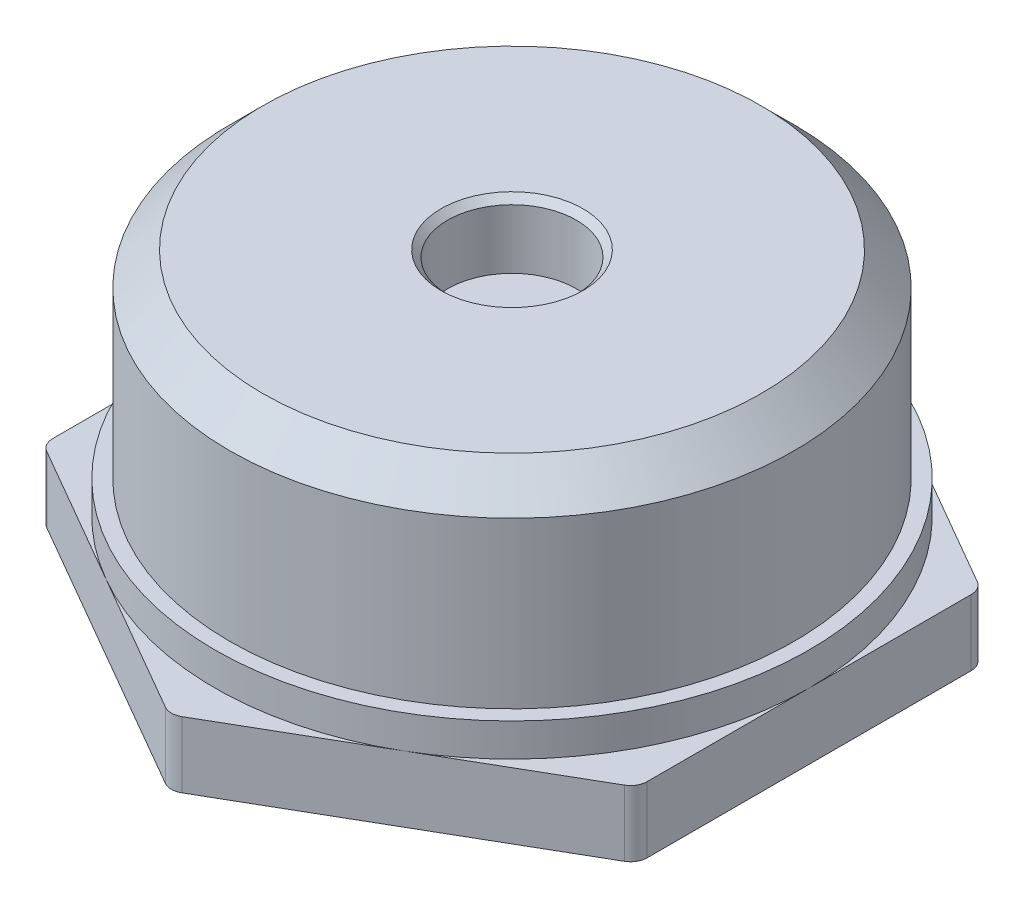
from build123d import *

# Parameters (mm, degrees)
BOSS_EXTRUDE1_DEPTH      = 2
FILLET1_R                = 0.5
SKETCH2_R                = 9
BOSS_EXTRUDE2_DEPTH      = 1
SKETCH3_R                = 8.55
BOSS_EXTRUDE3_DEPTH      = 4
CUT_EXTRUDE1_DEPTH       = 16.375249198
BOSS_EXTRUDE4_DEPTH      = 1
BOSS_EXTRUDE4_DEPTH_BACK = 1
SKETCH5_R                = 8.55
SKETCH6_R                = 8.55
BOSS_EXTRUDE5_DEPTH      = 1
CHAMFER2_SIZE            = 1
SKETCH7_R                = 1.95
CUT_EXTRUDE2_DEPTH       = 2
CHAMFER3_SIZE            = 0.2


with BuildPart() as part:
    # Sketch1 → Boss-Extrude1 (new body)
    with BuildSketch(Plane(origin=(0, 31, 0), x_dir=(1, 0, 0), z_dir=(0, 1, 0))):
        Polygon((0, 10.392304845), (-9, 5.196152423), (-9, -5.196152423), (0, -10.392304845), (9, -5.196152423), (9, 5.196152423), align=None)
    extrude(amount=BOSS_EXTRUDE1_DEPTH)

    # Fillet1
    fillet1_edges = [part.edges().sort_by_distance(p)[0] for p in [
        (0, 32, -10.392304845),
        (-9, 32, -5.196152423),
        (-9, 32, 5.196152423),
        (0, 32, 10.392304845),
        (9, 32, 5.196152423),
        (9, 32, -5.196152423),
    ]]
    fillet(fillet1_edges, radius=FILLET1_R)

    # Sketch2 → Boss-Extrude2 (add)
    with BuildSketch(Plane(origin=(0, 33, 0), x_dir=(1, 0, 0), z_dir=(0, 1, 0))):
        Circle(SKETCH2_R)
    extrude(amount=BOSS_EXTRUDE2_DEPTH)

    # Sketch3 → Boss-Extrude3 (add)
    with BuildSketch(Plane(origin=(0, 34, 0), x_dir=(1, 0, 0), z_dir=(0, 1, 0))):
        Circle(SKETCH3_R)
    extrude(amount=BOSS_EXTRUDE3_DEPTH)

    # Sketch4 → Cut-Extrude1 (cut, through all)
    with BuildSketch(Plane(origin=(0, 38, 0), x_dir=(1, 0, 0), z_dir=(0, 1, 0))):
        Polygon((0, 2.886751346), (-2.5, 1.443375673), (-2.5, -1.443375673), (0, -2.886751346), (2.5, -1.443375673), (2.5, 1.443375673), align=None)
    extrude(amount=-CUT_EXTRUDE1_DEPTH, mode=Mode.SUBTRACT)

    # Sketch5 → Boss-Extrude4 (add, two sides: drawn at the far end of the back side and taken through both)
    with BuildSketch(Plane(origin=(0, 38, 0), x_dir=(1, 0, 0), z_dir=(0, 1, 0)).offset(-BOSS_EXTRUDE4_DEPTH_BACK)):
        Circle(SKETCH5_R)
    extrude(amount=BOSS_EXTRUDE4_DEPTH + BOSS_EXTRUDE4_DEPTH_BACK)

    # Sketch6 → Boss-Extrude5 (add)
    with BuildSketch(Plane(origin=(0, 39, 0), x_dir=(1, 0, 0), z_dir=(0, 1, 0))):
        Circle(SKETCH6_R)
    extrude(amount=BOSS_EXTRUDE5_DEPTH)

    # Chamfer2
    chamfer2_edges = [part.edges().sort_by_distance(p)[0] for p in [
        (-8.55, 40, 0),
    ]]
    chamfer(chamfer2_edges, length=CHAMFER2_SIZE)

    # Sketch7 → Cut-Extrude2 (cut)
    with BuildSketch(Plane(origin=(0, 40, 0), x_dir=(1, 0, 0), z_dir=(0, 1, 0))):
        Circle(SKETCH7_R)
    extrude(amount=-CUT_EXTRUDE2_DEPTH, mode=Mode.SUBTRACT)

    # Chamfer3
    chamfer3_edges = [part.edges().sort_by_distance(p)[0] for p in [
        (-1.95, 40, 0),
    ]]
    chamfer(chamfer3_edges, length=CHAMFER3_SIZE)


solid = part.part
